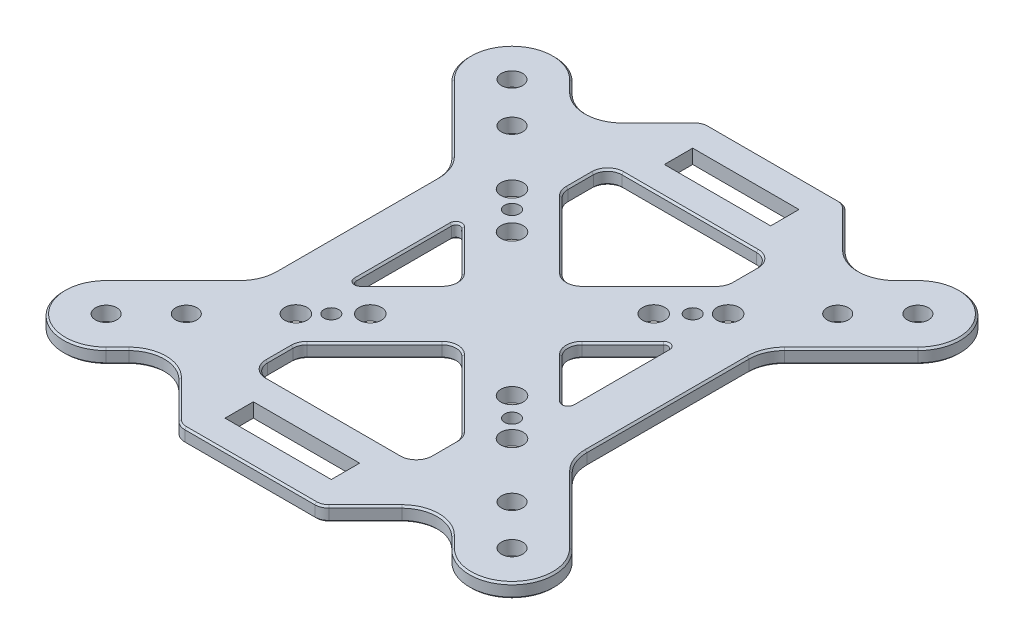
from build123d import *

# Parameters (mm, degrees)
SKETCH1_R           = 1.5
SKETCH1_R_2         = 1.575
SKETCH1_R_3         = 1.05
BOSS_EXTRUDE1_DEPTH = 2
MIRROR1_OUTLINE_R   = 1.5
MIRROR1_OUTLINE_R_2 = 1.575
MIRROR1_OUTLINE_R_3 = 1.05
MIRROR1_OUTLINE_W   = 15
MIRROR1_OUTLINE_H   = 4
MIRROR1_DEPTH       = 2
FILLET1_R           = 2
FILLET2_R           = 0.6
CHAMFER1_SIZE       = 0.25


# Read off the part's stored shape, not the designer's step: Mirror1
with BuildPart() as part:
    # Sketch1 → Boss-Extrude1 (new body)
    with BuildSketch(Plane(origin=(0, 0, 0), x_dir=(1, 0, 0), z_dir=(0, 1, 0))):
        with BuildLine():
            Line((-7.071067812, 0), (0, 0))
            Line((0, 0), (0, 7.071067812))
            Line((0, 7.071067812), (-11.5, 18.571067812))
            Line((-11.5, 18.571067812), (-11.5, 25))
            Line((-11.5, 25), (0, 25))
            Line((0, 25), (0, 29))
            Line((0, 29), (-7.5, 29))
            Line((-7.5, 29), (-7.5, 33))
            Line((-7.5, 33), (0, 33))
            Line((0, 33), (0, 37))
            Line((0, 37), (-9.171572875, 37))
            ThreePointArc((-9.171572875, 37), (-9.93693974, 36.847759065), (-10.585786438, 36.414213562))
            Line((-10.585786438, 36.414213562), (-15.721825407, 31.278174593))
            ThreePointArc((-15.721825407, 31.278174593), (-19.257359313, 29.813708499), (-22.792893219, 31.278174593))
            Line((-22.792893219, 31.278174593), (-24.395183951, 32.880465325))
            ThreePointArc((-24.395183951, 32.880465325), (-32.880465325, 32.880465325), (-32.880465325, 24.395183951))
            Line((-32.880465325, 24.395183951), (-23.464466094, 14.97918472))
            ThreePointArc((-23.464466094, 14.97918472), (-22.380602337, 13.357067976), (-22, 11.443650814))
            Line((-22, 11.443650814), (-22, 0))
            Line((-22, 0), (-15.25, 0))
            Line((-15.25, 0), (-15.25, 8.178932188))
            Line((-15.25, 8.178932188), (-7.071067812, 0))
        make_face()
        with Locations(Location((-28.637824638, 28.637824638, 0), (0, 0, 270))):
            Circle(SKETCH1_R, mode=Mode.SUBTRACT)
        with Locations(Location((-22.980970389, 22.980970389, 0), (0, 0, 270))):
            Circle(SKETCH1_R, mode=Mode.SUBTRACT)
        with Locations(Location((-15.25, 15.25, 0), (0, 0, 270))):
            Circle(SKETCH1_R_2, mode=Mode.SUBTRACT)
        with Locations(Location((-12.75, 12.75, 0), (0, 0, 270))):
            Circle(SKETCH1_R_3, mode=Mode.SUBTRACT)
        with Locations(Location((-10, 10, 0), (0, 0, 270))):
            Circle(SKETCH1_R_2, mode=Mode.SUBTRACT)
    extrude(amount=BOSS_EXTRUDE1_DEPTH)

    # Mirror1 outline → Mirror1 (add)
    with BuildSketch(Plane(origin=(0, 0, 0), x_dir=(1, 0, 0), z_dir=(0, 1, 0))):
        with BuildLine():
            Line((32.880465325, -24.395183951), (23.464466094, -14.97918472))
            ThreePointArc((23.464466094, -14.97918472), (22.380602337, -13.357067976), (22, -11.443650814))
            Line((22, -11.443650814), (22, 11.443650814))
            ThreePointArc((22, 11.443650814), (22.380602337, 13.357067976), (23.464466094, 14.97918472))
            Line((23.464466094, 14.97918472), (32.880465325, 24.395183951))
            ThreePointArc((32.880465325, 24.395183951), (32.880465325, 32.880465325), (24.395183951, 32.880465325))
            Line((24.395183951, 32.880465325), (22.792893219, 31.278174593))
            ThreePointArc((22.792893219, 31.278174593), (19.257359313, 29.813708499), (15.721825407, 31.278174593))
            Line((15.721825407, 31.278174593), (10.585786438, 36.414213562))
            ThreePointArc((10.585786438, 36.414213562), (9.93693974, 36.847759065), (9.171572875, 37))
            Line((9.171572875, 37), (0, 37))
            Line((0, 37), (0, 33))
            Line((0, 33), (7.5, 33))
            Line((7.5, 33), (7.5, 29))
            Line((7.5, 29), (0, 29))
            Line((0, 29), (0, 25))
            Line((0, 25), (11.5, 25))
            Line((11.5, 25), (11.5, 18.571067812))
            Line((11.5, 18.571067812), (0, 7.071067812))
            Line((0, 7.071067812), (0, 0))
            Line((0, 0), (-7.071067812, 0))
            Line((-7.071067812, 0), (-15.25, -8.178932188))
            Line((-15.25, -8.178932188), (-15.25, 0))
            Line((-15.25, 0), (-22, 0))
            Line((-22, 0), (-22, -11.443650814))
            ThreePointArc((-22, -11.443650814), (-22.380602337, -13.357067976), (-23.464466094, -14.97918472))
            Line((-23.464466094, -14.97918472), (-32.880465325, -24.395183951))
            ThreePointArc((-32.880465325, -24.395183951), (-32.880465325, -32.880465325), (-24.395183951, -32.880465325))
            Line((-24.395183951, -32.880465325), (-22.792893219, -31.278174593))
            ThreePointArc((-22.792893219, -31.278174593), (-19.257359313, -29.813708499), (-15.721825407, -31.278174593))
            Line((-15.721825407, -31.278174593), (-10.585786438, -36.414213562))
            ThreePointArc((-10.585786438, -36.414213562), (-9.93693974, -36.847759065), (-9.171572875, -37))
            Line((-9.171572875, -37), (9.171572875, -37))
            ThreePointArc((9.171572875, -37), (9.93693974, -36.847759065), (10.585786438, -36.414213562))
            Line((10.585786438, -36.414213562), (15.721825407, -31.278174593))
            ThreePointArc((15.721825407, -31.278174593), (19.257359313, -29.813708499), (22.792893219, -31.278174593))
            Line((22.792893219, -31.278174593), (24.395183951, -32.880465325))
            ThreePointArc((24.395183951, -32.880465325), (32.880465325, -32.880465325), (32.880465325, -24.395183951))
        make_face()
        with Locations((-28.637824638, -28.637824638)):
            Circle(MIRROR1_OUTLINE_R, mode=Mode.SUBTRACT)
        with Locations((-22.980970389, -22.980970389)):
            Circle(MIRROR1_OUTLINE_R, mode=Mode.SUBTRACT)
        with Locations((-15.25, -15.25)):
            Circle(MIRROR1_OUTLINE_R_2, mode=Mode.SUBTRACT)
        with Locations((-12.75, -12.75)):
            Circle(MIRROR1_OUTLINE_R_3, mode=Mode.SUBTRACT)
        with Locations((-10, -10)):
            Circle(MIRROR1_OUTLINE_R_2, mode=Mode.SUBTRACT)
        with Locations((0, -31)):
            Rectangle(MIRROR1_OUTLINE_W, MIRROR1_OUTLINE_H, mode=Mode.SUBTRACT)
        with Locations((28.637824638, -28.637824638)):
            Circle(MIRROR1_OUTLINE_R, mode=Mode.SUBTRACT)
        with Locations((22.980970389, -22.980970389)):
            Circle(MIRROR1_OUTLINE_R, mode=Mode.SUBTRACT)
        Polygon((-11.5, -18.571067812), (0, -7.071067812), (11.5, -18.571067812), (11.5, -25), (-11.5, -25), align=None, mode=Mode.SUBTRACT)
        with Locations((15.25, -15.25)):
            Circle(MIRROR1_OUTLINE_R_2, mode=Mode.SUBTRACT)
        with Locations((12.75, -12.75)):
            Circle(MIRROR1_OUTLINE_R_3, mode=Mode.SUBTRACT)
        with Locations((10, -10)):
            Circle(MIRROR1_OUTLINE_R_2, mode=Mode.SUBTRACT)
        Polygon((15.25, -8.178932188), (7.071067812, 0), (15.25, 8.178932188), align=None, mode=Mode.SUBTRACT)
        with Locations((10, 10)):
            Circle(MIRROR1_OUTLINE_R_2, mode=Mode.SUBTRACT)
        with Locations((12.75, 12.75)):
            Circle(MIRROR1_OUTLINE_R_3, mode=Mode.SUBTRACT)
        with Locations((15.25, 15.25)):
            Circle(MIRROR1_OUTLINE_R_2, mode=Mode.SUBTRACT)
        with Locations((22.980970389, 22.980970389)):
            Circle(MIRROR1_OUTLINE_R, mode=Mode.SUBTRACT)
        with Locations((28.637824638, 28.637824638)):
            Circle(MIRROR1_OUTLINE_R, mode=Mode.SUBTRACT)
    extrude(amount=MIRROR1_DEPTH)

    # Fillet1
    fillet1_edges = [part.edges().sort_by_distance(p)[0] for p in [
        (-11.5, 1, 25),
        (-11.5, 1, 18.571067812),
        (0, 1, 7.071067812),
        (11.5, 1, 18.571067812),
        (11.5, 1, 25),
        (-11.5, 1, -25),
        (-11.5, 1, -18.571067812),
        (0, 1, -7.071067812),
        (-7.071067812, 1, 0),
        (11.5, 1, -25),
        (11.5, 1, -18.571067812),
        (7.071067812, 1, 0),
    ]]
    fillet(fillet1_edges, radius=FILLET1_R)

    # Fillet2
    fillet2_edges = [part.edges().sort_by_distance(p)[0] for p in [
        (-15.25, 1, 8.178932188),
        (15.25, 1, 8.178932188),
        (-15.25, 1, -8.178932188),
        (15.25, 1, -8.178932188),
    ]]
    fillet(fillet2_edges, radius=FILLET2_R)

    # Chamfer1
    chamfer1_edges = [part.edges().sort_by_distance(p)[0] for p in [
        (-23.594038585, 2, -32.079319959),
        (-9.93693974, 2, -36.847759065),
        (-13.153805922, 2, -33.846194078),
        (-19.257359313, 2, -29.813708499),
        (-23.594038585, 0, 32.079319959),
        (-19.257359313, 0, 29.813708499),
        (-13.153805923, 2, 33.846194078),
        (-9.93693974, 2, 36.847759065),
        (0, 2, 37),
        (-22.380602337, 0, 13.357067976),
        (-28.17246571, 2, 19.687184335),
        (-32.880465325, 2, 32.880465325),
        (-23.594038585, 2, 32.079319959),
        (-19.257359313, 2, 29.813708499),
        (-32.880465325, 2, -32.880465325),
        (-22.380602337, 2, 13.357067976),
        (-32.880465325, 0, 32.880465325),
        (-28.17246571, 0, 19.687184335),
        (0, 0, 37),
        (-9.93693974, 0, 36.847759065),
        (-13.153805923, 0, 33.846194078),
        (23.594038585, 2, 32.079319959),
        (32.880465325, 0, 32.880465325),
        (28.17246571, 0, 19.687184335),
        (22.380602337, 2, 13.357067976),
        (9.93693974, 0, 36.847759065),
        (13.153805923, 0, 33.846194078),
        (19.257359313, 2, 29.813708499),
        (32.880465325, 2, 32.880465325),
        (28.17246571, 2, 19.687184335),
        (9.93693974, 2, 36.847759065),
        (13.153805923, 2, 33.846194078),
        (23.594038585, 0, 32.079319959),
        (19.257359313, 0, 29.813708499),
        (22.380602337, 0, 13.357067976),
        (-28.17246571, 2, -19.687184335),
        (-22.380602337, 2, -13.357067976),
        (6.164213562, 0, 13.235281374),
        (6.164213562, 2, 13.235281374),
        (-6.164213562, 0, 13.235281374),
        (-6.164213562, 2, 13.235281374),
        (-6.164213562, 0, -13.235281374),
        (-6.164213562, 2, -13.235281374),
        (6.164213562, 0, -13.235281374),
        (6.164213562, 2, -13.235281374),
        (-11.5, 0, -21.199747468),
        (-11.5, 2, -21.199747468),
        (11.5, 0, -21.199747468),
        (11.5, 2, -21.199747468),
        (11.5, 0, 21.199747468),
        (11.5, 2, 21.199747468),
        (-11.5, 0, 21.199747468),
        (-11.5, 2, 21.199747468),
        (0, 0, 25),
        (0, 2, 25),
        (0, 0, -25),
        (0, 2, -25),
        (-7.899494937, 0, 0),
        (-7.899494937, 2, 0),
        (7.899494937, 0, 0),
        (7.899494937, 2, 0),
        (0, 0, 7.899494937),
        (0, 2, 7.899494937),
        (0, 0, -7.899494937),
        (-22, 2, 0),
        (0, 2, -7.899494937),
        (-11.347759065, 0, -18.634128072),
        (-11.347759065, 2, -18.634128072),
        (11.347759065, 0, -18.634128072),
        (11.347759065, 2, -18.634128072),
        (11.347759065, 0, 18.634128072),
        (11.347759065, 2, 18.634128072),
        (-11.347759065, 0, 18.634128072),
        (-11.347759065, 2, 18.634128072),
        (-19.257359313, 0, -29.813708499),
        (-10.914213562, 0, 24.414213562),
        (-10.914213562, 2, 24.414213562),
        (-13.153805922, 0, -33.846194078),
        (10.914213562, 0, 24.414213562),
        (10.914213562, 2, 24.414213562),
        (10.914213562, 0, -24.414213562),
        (-9.93693974, 0, -36.847759065),
        (10.914213562, 2, -24.414213562),
        (-10.914213562, 0, -24.414213562),
        (0, 0, -37),
        (-10.914213562, 2, -24.414213562),
        (-22, 0, 0),
        (-22.380602337, 0, -13.357067976),
        (11.355508653, 0, 4.284440841),
        (11.355508653, 2, 4.284440841),
        (15.25, 0, 0),
        (15.25, 2, 0),
        (11.355508653, 2, -4.284440841),
        (11.355508653, 0, -4.284440841),
        (-15.25, 0, 0),
        (-28.17246571, 0, -19.687184335),
        (-15.25, 2, 0),
        (-11.355508653, 2, 4.284440841),
        (-11.355508653, 0, 4.284440841),
        (-11.355508653, 0, -4.284440841),
        (-11.355508653, 2, -4.284440841),
        (14.879610059, 0, 7.28473177),
        (-32.880465325, 0, -32.880465325),
        (14.879610059, 2, 7.28473177),
        (14.879610059, 0, -7.28473177),
        (14.879610059, 2, -7.28473177),
        (-23.594038585, 0, -32.079319959),
        (-14.879610059, 0, 7.28473177),
        (-14.879610059, 2, 7.28473177),
        (-14.879610059, 0, -7.28473177),
        (-14.879610059, 2, -7.28473177),
        (23.594038585, 0, -32.079319959),
        (19.257359313, 0, -29.813708499),
        (13.153805923, 2, -33.846194078),
        (9.93693974, 2, -36.847759065),
        (22, 0, 0),
        (22.380602337, 0, -13.357067976),
        (28.17246571, 2, -19.687184335),
        (32.880465325, 2, -32.880465325),
        (23.594038585, 2, -32.079319959),
        (19.257359313, 2, -29.813708499),
        (22, 2, 0),
        (22.380602337, 2, -13.357067976),
        (0, 2, -37),
        (32.880465325, 0, -32.880465325),
        (28.17246571, 0, -19.687184335),
        (9.93693974, 0, -36.847759065),
        (13.153805923, 0, -33.846194078),
    ]]
    chamfer(chamfer1_edges, length=CHAMFER1_SIZE)


solid = part.part
